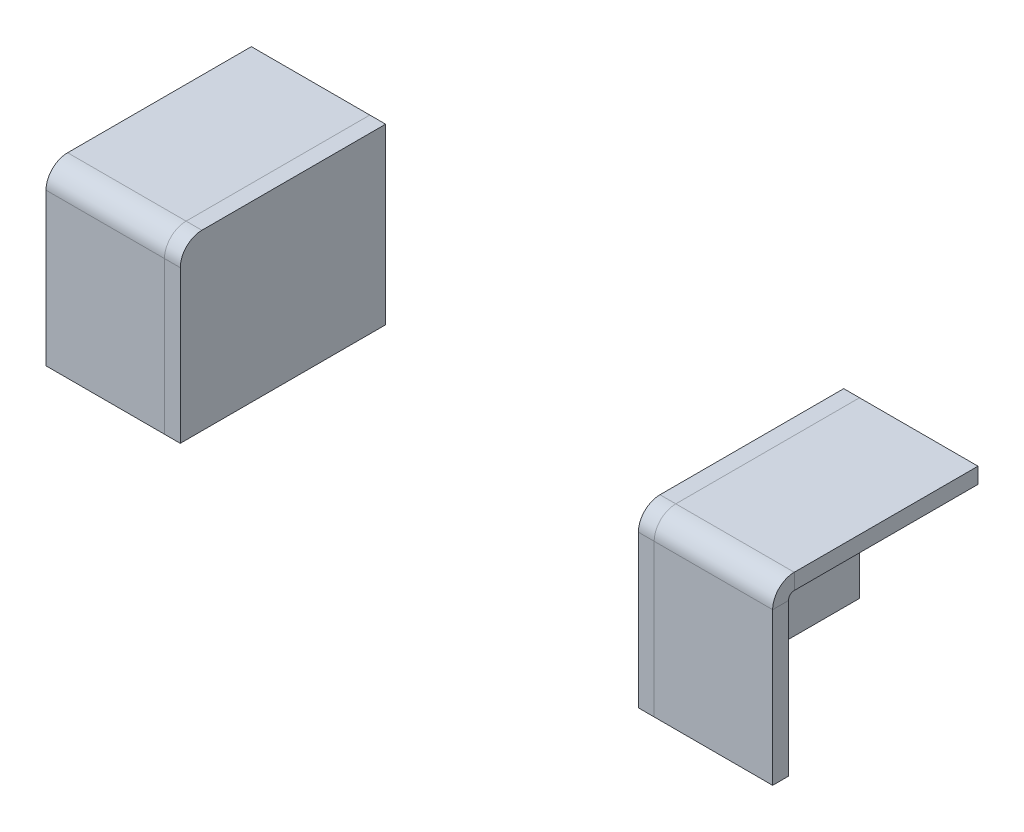
from build123d import *

# Parameters (mm, degrees)
SKETCH1_W                    = 15
SKETCH1_H                    = 26
BASE_FLANGE1_DEPTH           = 2
EDGE_FLANGE1_STRIP_W         = 9.4732
EDGE_FLANGE1_STRIP_H         = 2
EDGE_FLANGE1_STRIP_CUT_DEPTH = 15
EDGE_FLANGE1_DEPTH           = 15
BASE_FLANGE2_START           = 2
BASE_FLANGE2_DEPTH           = 2


# Sheet-metal steps are written as plain solids
with BuildPart() as part:
    # Sketch1 → Base-Flange1 (new body)
    with BuildSketch(Plane(origin=(0, 0, 0), x_dir=(1, 0, 0), z_dir=(0, 1, 0))):
        Rectangle(SKETCH1_W, SKETCH1_H)
    extrude(amount=-BASE_FLANGE1_DEPTH)

    # Edge-Flange1 strip (across the edge) → Edge-Flange1 strip cut (cut)
    with BuildSketch(Plane(origin=(7.5, -2, 13), x_dir=(0, 0, -1), z_dir=(-1, 0, 0))):
        with Locations((-2, -1)):
            Rectangle(EDGE_FLANGE1_STRIP_W, EDGE_FLANGE1_STRIP_H)
    extrude(amount=EDGE_FLANGE1_STRIP_CUT_DEPTH, mode=Mode.SUBTRACT)

    # Edge-Flange1 section (across the edge) → Edge-Flange1 (add)
    with BuildSketch(Plane(origin=(7.5, -2, 13), x_dir=(0, 0, -1), z_dir=(-1, 0, 0))):
        with BuildLine():
            Line((0, 0.7366), (0, 20))
            Line((0, 20), (2, 20))
            Line((2, 20), (2, 0.7366))
            ThreePointArc((2, 0.7366), (2.215745145, 0.215745145), (2.7366, 0))
            Line((2.7366, 0), (2.7366, -2))
            ThreePointArc((2.7366, -2), (0.801531583, -1.198468417), (0, 0.7366))
        make_face()
    extrude(amount=EDGE_FLANGE1_DEPTH)


with BuildPart() as body_2:
    # Sketch9 → Base-Flange2 (new body)
    with BuildSketch(Plane(origin=(7.5, 0, 0), x_dir=(0, 0, -1), z_dir=(1, 0, 0)).offset(BASE_FLANGE2_START)):
        with BuildLine():
            Line((-13, -22), (-13, -2.7366))
            ThreePointArc((-13, -2.7366), (-12.198468417, -0.801531583), (-10.2634, 0))
            Line((-10.2634, 0), (13, 0))
            Line((13, 0), (13, -22))
            Line((13, -22), (-13, -22))
        make_face()
    extrude(amount=-BASE_FLANGE2_DEPTH)


with BuildPart() as body_3:
    # Mirror1: mirrored copy
    add(part.part.mirror(Plane.ZY.offset(-38.5)))


with BuildPart() as body_4:
    # Mirror1 2: mirrored copy
    add(body_2.part.mirror(Plane.ZY.offset(-38.5)))


solid = Compound([part.part, body_2.part, body_3.part, body_4.part])
